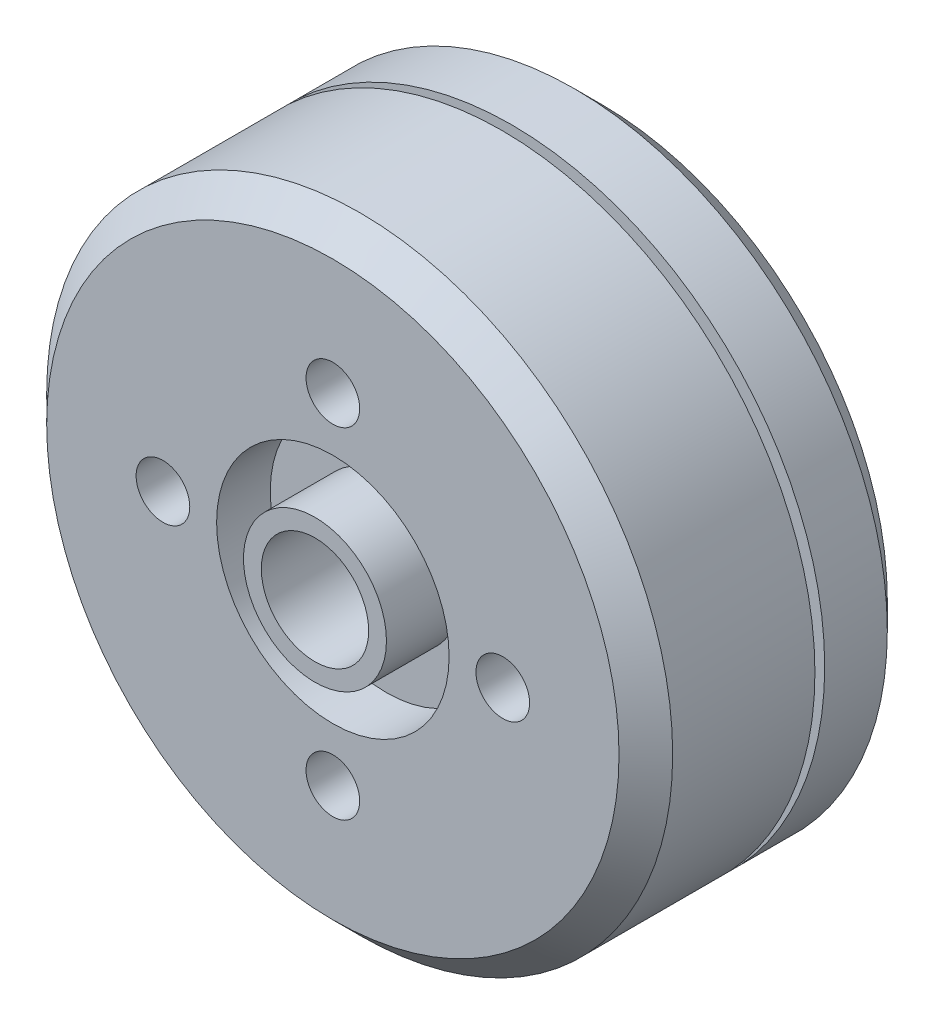
from build123d import *
from build123d.topology import SkipClean

# Parameters (mm, degrees)
SKETCH_1_R          = 17.5
EXTRUDE_1_DEPTH     = 15
SKETCH_2_R          = 1.5
CUT_EXTRUDE_1_DEPTH = 5
SKETCH_4_R          = 3
CUT_EXTRUDE_2_DEPTH = 20
SKETCH_5_R          = 1.5
CUT_EXTRUDE_3_DEPTH = 6
CHAMFER_1_SIZE      = 1.5
SKETCH_6_R          = 6.5
SKETCH_6_R_2        = 3.996615851
CUT_EXTRUDE_4_DEPTH = 3
SKETCH_7_R          = 3.996615851
SKETCH_7_R_2        = 3
EXTRUDE_2_DEPTH     = 1


with BuildPart() as part:
    # 草图1 → 凸台-拉伸1 (new body)
    with BuildSketch(Plane.XY):
        Circle(SKETCH_1_R)
    extrude(amount=EXTRUDE_1_DEPTH)

    # 草图2 → 切除-拉伸1 (cut)
    with BuildSketch(Plane(origin=(0, 0, 0), x_dir=(-1, 0, 0), z_dir=(0, 0, -1))):
        with Locations((0, -8)):
            Circle(SKETCH_2_R)
        with Locations((-8, 0)):
            Circle(SKETCH_2_R)
        with Locations((0, 8)):
            Circle(SKETCH_2_R)
        with Locations((8, 0)):
            Circle(SKETCH_2_R)
    extrude(amount=-CUT_EXTRUDE_1_DEPTH, mode=Mode.SUBTRACT)

    # 草图3 → 切除-旋转1 (revolve, cut)
    with BuildSketch(Plane(origin=(0, 0, 0), x_dir=(1, 0, 0), z_dir=(0, 1, 0))):
        Polygon((17.969347124, -5), (17.969347124, -5.546855429), (13.284433797, -5.546855429), (13.284433797, -5.046855429), (13.284433797, -5), align=None)
    revolve(axis=Axis((0, 0, 0), (0, 0, 1)), mode=Mode.SUBTRACT)

    # 草图4 → 切除-拉伸2 (cut)
    with BuildSketch(Plane(origin=(0, 0, 0), x_dir=(-1, 0, 0), z_dir=(0, 0, -1))):
        Circle(SKETCH_4_R)
    extrude(amount=-CUT_EXTRUDE_2_DEPTH, mode=Mode.SUBTRACT)

    # 草图5 → 切除-拉伸3 (cut)
    with BuildSketch(Plane.XY.offset(15)):
        with Locations((0, -9.5)):
            Circle(SKETCH_5_R)
        with Locations((-9.5, 0)):
            Circle(SKETCH_5_R)
        with Locations((0, 9.5)):
            Circle(SKETCH_5_R)
        with Locations((9.5, 0)):
            Circle(SKETCH_5_R)
    extrude(amount=-CUT_EXTRUDE_3_DEPTH, mode=Mode.SUBTRACT)

    # 倒角1
    chamfer_1_edges = [part.edges().sort_by_distance(p)[0] for p in [
        (-17.5, 0, 15),
        (-17.5, 0, 0),
    ]]
    chamfer(chamfer_1_edges, length=CHAMFER_1_SIZE)

    # 草图6 → 切除-拉伸4 (cut)
    with BuildSketch(Plane.XY.offset(15)):
        Circle(SKETCH_6_R)
        Circle(SKETCH_6_R_2, mode=Mode.SUBTRACT)
    extrude(amount=-CUT_EXTRUDE_4_DEPTH, mode=Mode.SUBTRACT)

    # 草图7 → 凸台-拉伸2 (add)
    with SkipClean():  # the faces are left unmerged after this step: merging them gives an invalid solid
        with BuildSketch(Plane.XY.offset(15)):
            Circle(SKETCH_7_R)
            Circle(SKETCH_7_R_2, mode=Mode.SUBTRACT)
        extrude(amount=EXTRUDE_2_DEPTH)


solid = part.part
